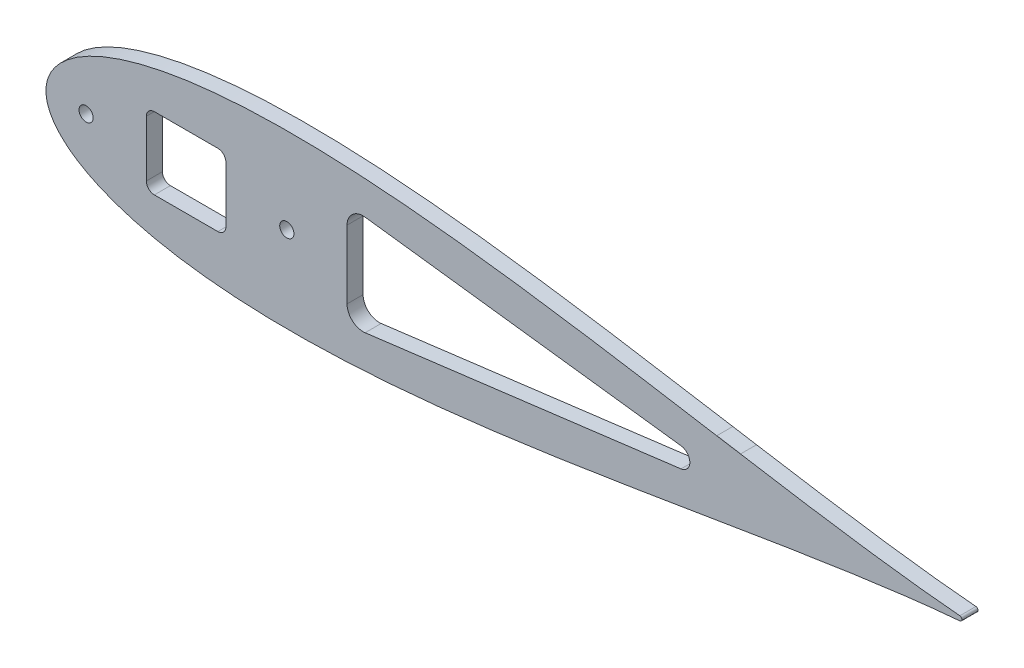
from build123d import *

# Parameters (mm, degrees)
BOSS_EXTRUDE1_DEPTH   = 5.4737
SCALE1_SCALE          = 0.45
BOSS_EXTRUDE2_DEPTH   = 5.08
SKETCH10_W            = 25.167167629
SKETCH10_H            = 22.8092
CUT_EXTRUDE6_DEPTH    = 292.099276361
FILLET1_R             = 2.54
F_8_CLEARANCE_HOLE1_D = 4.4958
CUT_EXTRUDE11_DEPTH   = 292.099276361
FILLET2_R             = 5.08
FILLET3_R             = 3.192266


with BuildPart() as part:
    # Sketch2 → Boss-Extrude1 (new body)
    with BuildSketch(Plane.XY):
        with BuildLine():
            add(Edge.make_bspline(
                [(642.510849283, 1.582039112), (641.993392355, 1.625070631), (638.093728429, 1.953546407), (630.413817462, 2.663385493), (619.014124193, 3.849253664), (606.374988512, 5.304428983), (592.543922516, 7.037634907), (577.585454095, 9.050636147), (561.564270734, 11.338919625), (544.549749946, 13.890665375), (526.614143658, 16.687720753), (507.832591566, 19.705111663), (488.282710288, 22.911672601), (468.044367735, 26.27043606), (447.199424328, 29.739007432), (425.831595832, 33.270324121), (404.02631566, 36.813220545), (381.870662856, 40.313266856), (359.453314895, 43.713502532), (336.86454415, 46.955447457), (314.196207315, 49.979843895), (291.541767704, 52.727712704), (268.996310773, 55.141201012), (246.65655865, 57.164603829), (224.620860897, 58.745176641), (202.989192599, 59.8341217), (181.863132616, 60.387506142), (161.345829027, 60.366961324), (141.542033828, 59.739895824), (122.558104573, 58.481758104), (104.502313427, 56.574303932), (87.485018636, 54.008935199), (71.619696083, 50.784752003), (57.023709725, 46.912543066), (43.82045433, 42.41500246), (32.141645239, 37.332204029), (22.129107375, 31.731455339), (13.932423524, 25.726412106), (7.689616489, 19.513207632), (3.463136343, 13.420354421), (1.106333228, 7.923389435), (0.154611582, 3.513796615), (-0.062151598, 0), (0.154611582, -3.513796615), (1.106333228, -7.923389435), (3.463136343, -13.420354421), (7.689616489, -19.513207632), (13.932423524, -25.726412106), (22.129107375, -31.731455339), (32.141645239, -37.332204029), (43.82045433, -42.41500246), (57.023709725, -46.912543066), (71.619696083, -50.784752003), (87.485018636, -54.008935199), (104.502313427, -56.574303932), (122.558104573, -58.481758104), (141.542033828, -59.739895824), (161.345829027, -60.366961324), (181.863132616, -60.387506142), (202.989192599, -59.8341217), (224.620860897, -58.745176641), (246.65655865, -57.164603829), (268.996310773, -55.141201012), (291.541767704, -52.727712704), (314.196207315, -49.979843895), (336.86454415, -46.955447457), (359.453314895, -43.713502532), (381.870662856, -40.313266856), (404.02631566, -36.813220545), (425.831595832, -33.270324121), (447.199424328, -29.739007432), (468.044367735, -26.27043606), (488.282710288, -22.911672601), (507.832591566, -19.705111663), (526.614143658, -16.687720753), (544.549749946, -13.890665375), (561.564270734, -11.338919625), (577.585454095, -9.050636147), (592.543922516, -7.037634907), (606.374988512, -5.304428983), (619.014124193, -3.849253664), (630.413817462, -2.663385493), (638.093728429, -1.953546407), (641.993392355, -1.625070631), (642.510849283, -1.582039112)],
                knots=[0.020157042, 0.020157042, 0.020157042, 0.020157042, 0.021270888, 0.028552555, 0.036780684, 0.045920102, 0.055931764, 0.066772884, 0.07839713, 0.090754827, 0.103793165, 0.117456432, 0.131686226, 0.146421738, 0.161599998, 0.177156133, 0.193023668, 0.209134786, 0.225420633, 0.241811602, 0.258237647, 0.274628557, 0.290914287, 0.307025229, 0.322892517, 0.338448342, 0.353626207, 0.368361232, 0.382590428, 0.396252961, 0.409290412, 0.42164701, 0.433269881, 0.444109249, 0.45411864, 0.463255055, 0.471479114, 0.478755289, 0.485052318, 0.490344026, 0.494609833, 0.497833231, 0.5, 0.502166769, 0.505390167, 0.509655974, 0.514947682, 0.521244711, 0.528520886, 0.536744945, 0.54588136, 0.555890751, 0.566730119, 0.57835299, 0.590709588, 0.603747039, 0.617409572, 0.631638768, 0.646373793, 0.661551658, 0.677107483, 0.692974771, 0.709085713, 0.725371443, 0.741762353, 0.758188398, 0.774579367, 0.790865214, 0.806976332, 0.822843867, 0.838400002, 0.853578262, 0.868313774, 0.882543568, 0.896206835, 0.909245173, 0.92160287, 0.933227116, 0.944068236, 0.954079898, 0.963219316, 0.971447445, 0.978729112, 0.979842958, 0.979842958, 0.979842958, 0.979842958], degree=3))
            ThreePointArc((642.510849283, -1.582039112), (643.966787522, 0), (642.510849283, 1.582039112))
        make_face()
    extrude(amount=BOSS_EXTRUDE1_DEPTH)


with BuildPart() as part_1:
    # Scale1: scaled about (0, 0, 0)
    add(part.part.scale(SCALE1_SCALE))

    # Sketch13 → Boss-Extrude2 (add)
    with BuildSketch(Plane.XY):
        with BuildLine():
            ThreePointArc((289.129882177, -0.711917601), (289.785054385, 0), (289.129882177, 0.711917601))
            add(Edge.make_bspline(
                [(289.129882177, 0.711917601), (288.89702656, 0.731281784), (287.142177793, 0.879095883), (283.686217858, 1.198523472), (278.556355887, 1.732164149), (272.868744831, 2.386993043), (266.644765132, 3.166935708), (259.913454343, 4.072786266), (252.703921831, 5.102513831), (245.047387476, 6.250799419), (236.976364646, 7.509474339), (228.524666205, 8.867300248), (219.72721963, 10.31025267), (210.619965481, 11.821696227), (201.239740948, 13.382553344), (191.624218124, 14.971645854), (181.811842047, 16.565949245), (171.841798285, 18.140970085), (161.753991703, 19.67107614), (151.589044868, 21.129951356), (141.388293292, 22.490929753), (131.193795467, 23.727470717), (121.048339848, 24.813540455), (110.995451392, 25.724071723), (101.079387404, 26.435329489), (91.34513667, 26.925354765), (81.838409677, 27.174377764), (72.605623062, 27.165132596), (63.693915223, 26.882953121), (55.151147058, 26.316791147), (47.026041042, 25.45843677), (39.368258386, 24.30402084), (32.228863237, 22.853138401), (25.660669376, 21.11064438), (19.719204449, 19.086751107), (14.463740357, 16.799491813), (9.958098319, 14.279154902), (6.269590586, 11.576885448), (3.46032742, 8.780943434), (1.558411354, 6.039159489), (0.497849952, 3.565525246), (0.069575212, 1.581208477), (-0.027968219, 0), (0.069575212, -1.581208477), (0.497849952, -3.565525246), (1.558411354, -6.039159489), (3.46032742, -8.780943434), (6.269590586, -11.576885448), (9.958098319, -14.279154902), (14.463740357, -16.799491813), (19.719204449, -19.086751107), (25.660669376, -21.11064438), (32.228863237, -22.853138401), (39.368258386, -24.30402084), (47.026041042, -25.45843677), (55.151147058, -26.316791147), (63.693915223, -26.882953121), (72.605623062, -27.165132596), (81.838409677, -27.174377764), (91.34513667, -26.925354765), (101.079387404, -26.435329489), (110.995451392, -25.724071723), (121.048339848, -24.813540455), (131.193795467, -23.727470717), (141.388293292, -22.490929753), (151.589044868, -21.129951356), (161.753991703, -19.67107614), (171.841798285, -18.140970085), (181.811842047, -16.565949245), (191.624218124, -14.971645854), (201.239740948, -13.382553344), (210.619965481, -11.821696227), (219.72721963, -10.31025267), (228.524666205, -8.867300248), (236.976364646, -7.509474339), (245.047387476, -6.250799419), (252.703921831, -5.102513831), (259.913454343, -4.072786266), (266.644765132, -3.166935708), (272.868744831, -2.386993043), (278.556355887, -1.732164149), (283.686217858, -1.198523472), (287.142177793, -0.879095883), (288.89702656, -0.731281784), (289.129882177, -0.711917601)],
                knots=[0.020157042, 0.020157042, 0.020157042, 0.020157042, 0.021270888, 0.028552555, 0.036780684, 0.045920102, 0.055931764, 0.066772884, 0.07839713, 0.090754827, 0.103793165, 0.117456432, 0.131686226, 0.146421738, 0.161599998, 0.177156133, 0.193023668, 0.209134786, 0.225420633, 0.241811602, 0.258237647, 0.274628557, 0.290914287, 0.307025229, 0.322892517, 0.338448342, 0.353626207, 0.368361232, 0.382590428, 0.396252961, 0.409290412, 0.42164701, 0.433269881, 0.444109249, 0.45411864, 0.463255055, 0.471479114, 0.478755289, 0.485052318, 0.490344026, 0.494609833, 0.497833231, 0.5, 0.502166769, 0.505390167, 0.509655974, 0.514947682, 0.521244711, 0.528520886, 0.536744945, 0.54588136, 0.555890751, 0.566730119, 0.57835299, 0.590709588, 0.603747039, 0.617409572, 0.631638768, 0.646373793, 0.661551658, 0.677107483, 0.692974771, 0.709085713, 0.725371443, 0.741762353, 0.758188398, 0.774579367, 0.790865214, 0.806976332, 0.822843867, 0.838400002, 0.853578262, 0.868313774, 0.882543568, 0.896206835, 0.909245173, 0.92160287, 0.933227116, 0.944068236, 0.954079898, 0.963219316, 0.971447445, 0.978729112, 0.979842958, 0.979842958, 0.979842958, 0.979842958], degree=3))
        make_face()
    extrude(amount=BOSS_EXTRUDE2_DEPTH)

    # Sketch10 → Cut-Extrude6 (cut, through all)
    with BuildSketch(Plane.XY.offset(5.08)):
        with Locations((44.333583815, 0)):
            Rectangle(SKETCH10_W, SKETCH10_H)
    extrude(amount=-CUT_EXTRUDE6_DEPTH, mode=Mode.SUBTRACT)

    # Fillet1
    fillet1_edges = [part_1.edges().sort_by_distance(p)[0] for p in [
        (56.917167629, 11.4046, 2.54),
        (56.917167629, -11.4046, 2.54),
        (31.75, -11.4046, 2.54),
        (31.75, 11.4046, 2.54),
    ]]
    fillet(fillet1_edges, radius=FILLET1_R)

    # #8 Clearance Hole1 (through all)
    with Locations(Plane.XY.offset(5.08)):
        with Locations((76.2, 0), (12.7, 0)):
            Hole(F_8_CLEARANCE_HOLE1_D / 2)

    # Sketch21 → Cut-Extrude11 (cut, through all)
    with BuildSketch(Plane(origin=(0, 0, 0), x_dir=(-1, 0, 0), z_dir=(0, 0, -1))):
        Polygon((-95.25, -16.55821986), (-95.25, 16.55821986), (-203.695498115, 2.813198261), (-203.695498115, -2.813198261), align=None)
    extrude(amount=-CUT_EXTRUDE11_DEPTH, mode=Mode.SUBTRACT)

    # Fillet2
    fillet2_edges = [part_1.edges().sort_by_distance(p)[0] for p in [
        (95.25, -16.55821986, 2.54),
        (95.25, 16.55821986, 2.54),
    ]]
    fillet(fillet2_edges, radius=FILLET2_R)

    # Fillet3
    fillet3_edges = [part_1.edges().sort_by_distance(p)[0] for p in [
        (203.695498115, -2.813198261, 2.54),
        (203.695498115, 2.813198261, 2.54),
    ]]
    fillet(fillet3_edges, radius=FILLET3_R - 0.0001)  # a hair under: the kernel refuses the full size


solid = part_1.part
